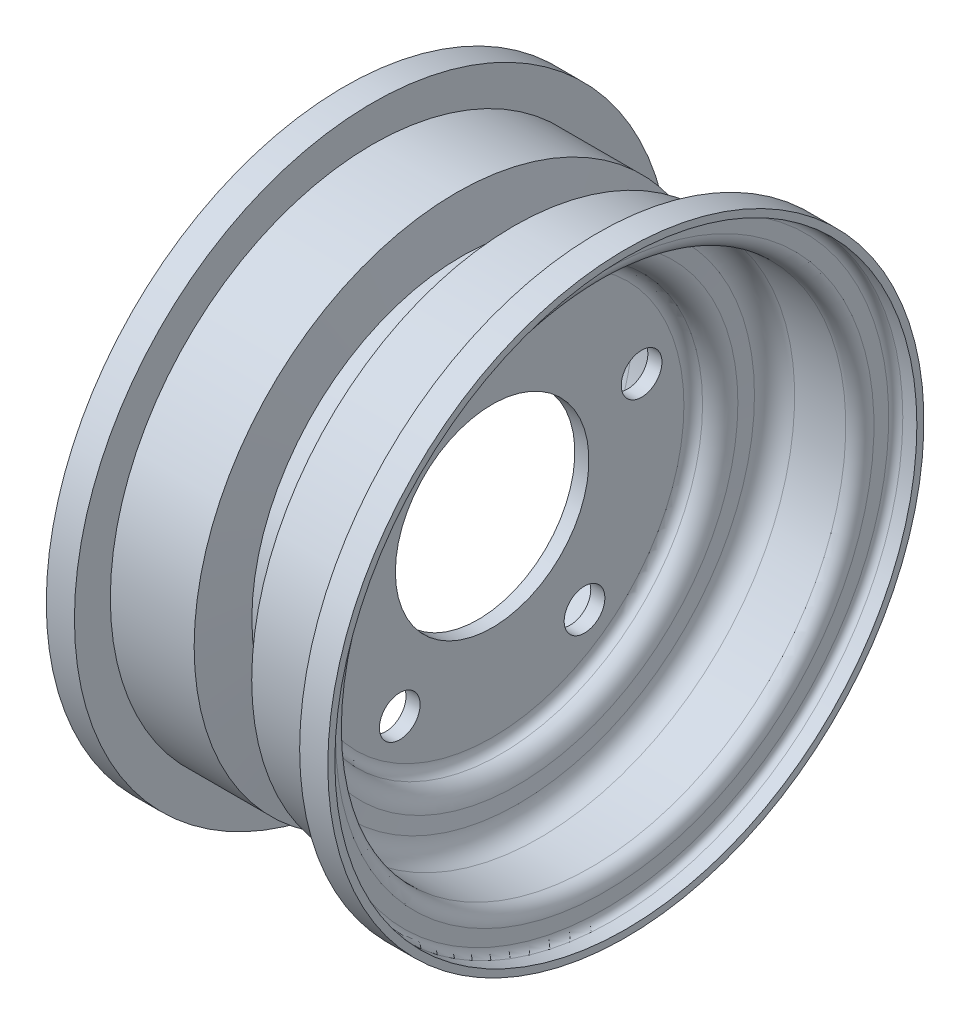
from build123d import *

# Parameters (mm, degrees)
F_37_64_0_57813_DIAMETER_HOLE1_D = 14.684502
FILLET1_R                        = 3.81
FILLET2_R                        = 7.62
FILLET3_R                        = 5.08
FILLET4_R                        = 2.54


with BuildPart() as part:
    # Sketch2 → Revolve2 (revolve)
    with BuildSketch(Plane.XY):
        Polygon((0, 34.925), (2.54, 34.925), (2.54, 73.025), (10.922, 73.025), (12.7, 92.075), (43.18, 92.075), (43.18, 105.029), (50.8, 105.029), (50.8, 107.569), (48.26, 107.569), (40.64, 107.569), (40.64, 94.615), (10.386027544, 94.615), (8.608027544, 75.565), (0, 75.565), align=None)
    revolve2 = revolve(axis=Axis((0, 0, 0), (1, 0, 0)))

    # Mirror1: Revolve2 across plane
    add(revolve2.mirror(Plane(origin=(0, 0, 0), x_dir=(0, 0, 1), z_dir=(1, 0, 0))))

    # 37/64 (0.57813) Diameter Hole1 (through all)
    with Locations(Plane(origin=(2.54, 0, 0), x_dir=(0, 0, -1), z_dir=(1, 0, 0))):
        with Locations((0, 56.717142647), (53.9412081, 17.52656095), (33.3375, -45.885132274), (-33.3375, -45.885132274), (-53.9412081, 17.52656095)):
            Hole(F_37_64_0_57813_DIAMETER_HOLE1_D / 2)

    # Fillet1
    fillet1_edges = [part.edges().sort_by_distance(p)[0] for p in [
        (2.54, -73.025, 0),
        (-2.54, -73.025, 0),
    ]]
    fillet(fillet1_edges, radius=FILLET1_R)

    # Fillet2
    fillet2_edges = [part.edges().sort_by_distance(p)[0] for p in [
        (12.7, -92.075, 0),
        (10.922, -73.025, 0),
        (-12.7, -92.075, 0),
        (-10.922, -73.025, 0),
    ]]
    fillet(fillet2_edges, radius=FILLET2_R)

    # Fillet3
    fillet3_edges = [part.edges().sort_by_distance(p)[0] for p in [
        (43.18, -92.075, 0),
        (-43.18, -92.075, 0),
    ]]
    fillet(fillet3_edges, radius=FILLET3_R)

    # Fillet4
    fillet4_edges = [part.edges().sort_by_distance(p)[0] for p in [
        (43.18, -105.029, 0),
        (-43.18, -105.029, 0),
    ]]
    fillet(fillet4_edges, radius=FILLET4_R)


solid = part.part
